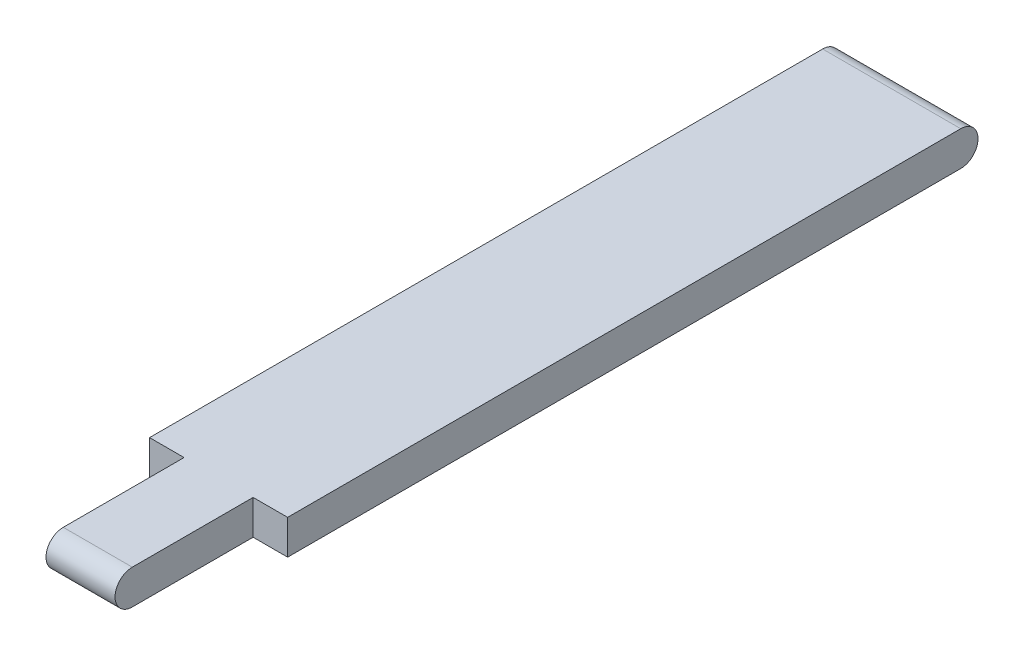
from build123d import *

# Parameters (mm, degrees)
EXTRUDE_1_DEPTH     = 4
SKETCH_5_W          = 2
SKETCH_5_H          = 8
CUT_EXTRUDE_2_DEPTH = 10


with BuildPart() as part:
    # 草图1 → 凸台-拉伸1 (new, symmetric)
    with BuildSketch(Plane(origin=(0, 0, 0), x_dir=(0, 0, -1), z_dir=(1, 0, 0))):
        with BuildLine():
            Line((-23, 1), (23, 1))
            ThreePointArc((23, 1), (24, 0), (23, -1))
            Line((23, -1), (-23, -1))
            ThreePointArc((-23, -1), (-24, 0), (-23, 1))
        make_face()
    extrude(amount=EXTRUDE_1_DEPTH, both=True)

    # 草图5 → 切除-拉伸2 (cut)
    with BuildSketch(Plane(origin=(0, 1, 0), x_dir=(1, 0, 0), z_dir=(0, 1, 0))):
        with Locations((-3, -20)):
            Rectangle(SKETCH_5_W, SKETCH_5_H)
        with Locations((3, -20)):
            Rectangle(SKETCH_5_W, SKETCH_5_H)
    extrude(amount=-CUT_EXTRUDE_2_DEPTH, mode=Mode.SUBTRACT)


solid = part.part
